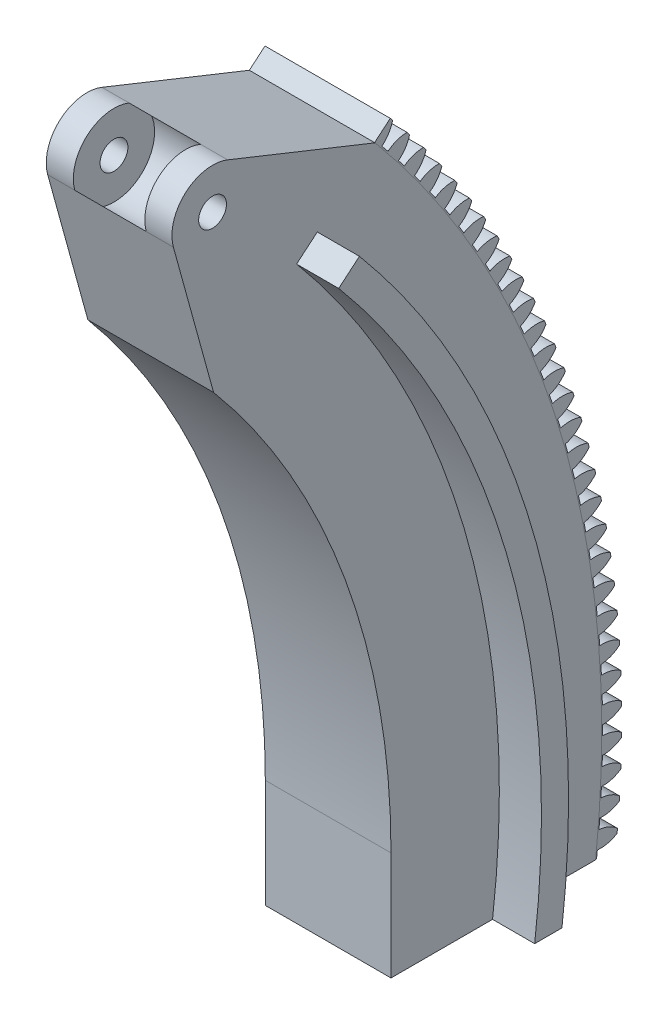
from build123d import *

# Parameters (mm, degrees)
BOSS_EXTRUDE2_DEPTH     = 6.35
BOSS_EXTRUDE3_DEPTH     = 29.464
CUT_EXTRUDE4_DEPTH      = 6.35
CIRPATTERN3_COUNT       = 230
CUT_EXTRUDE7_DEPTH      = 284.05774535
CUT_EXTRUDE7_DEPTH_BACK = 284.05774535
SKETCH15_R              = 3.2639
BOSS_EXTRUDE4_DEPTH     = 9.87425
BOSS_EXTRUDE6_START     = 23.01875
BOSS_EXTRUDE6_DEPTH     = 23.01875
SKETCH28_R              = 9.525
CUT_EXTRUDE8_DEPTH      = 16.764


with BuildPart() as part:
    # Sketch11 → Boss-Extrude2 (new body)
    with BuildSketch(Plane(origin=(6.35, 0, 0), x_dir=(0, 0, -1), z_dir=(1, 0, 0))):
        with BuildLine():
            Line((177.722316491, 149.126730219), (155.660230842, 130.614442288))
            ThreePointArc((155.660230842, 130.614442288), (190.945540544, 69.498493124), (203.2, 0))
            ThreePointArc((203.2, 0), (202.801171077, -12.724975829), (201.606249903, -25.4))
            Line((201.606249903, -25.4), (230.605384683, -25.4))
            ThreePointArc((230.605384683, -25.4), (231.65108936, -12.719129025), (232.000007424, 0))
            ThreePointArc((232.000007424, 0), (218.008694999, 79.348675791), (177.722316491, 149.126730219))
        make_face()
    extrude(amount=-BOSS_EXTRUDE2_DEPTH)

    # Sketch1 → Boss-Extrude3 (add)
    with BuildSketch(Plane(origin=(0, 0, 0), x_dir=(0, 0, -1), z_dir=(1, 0, 0))):
        with BuildLine():
            Line((177.8, 0), (177.8, -25.4))
            Line((177.8, -25.4), (225.775729431, -25.4))
            ThreePointArc((225.775729431, -25.4), (226.843652905, -12.71995034), (227.2, 0))
            ThreePointArc((227.2, 0), (213.498163443, 77.706976564), (174.045297477, 146.041344921))
            Line((174.045297477, 146.041344921), (139.503343029, 159.851365822))
            ThreePointArc((139.503343029, 159.851365822), (129.618020291, 158.107153482), (126.784391338, 148.47738561))
            Line((126.784391338, 148.47738561), (136.202701987, 114.287637002))
            ThreePointArc((136.202701987, 114.287637002), (167.077347976, 60.811181483), (177.8, 0))
        make_face()
    extrude(amount=BOSS_EXTRUDE3_DEPTH)

    # Sketch12 → Cut-Extrude4 (cut)
    with BuildSketch(Plane(origin=(6.35, 0, 0), x_dir=(0, 0, -1), z_dir=(1, 0, 0))):
        with BuildLine():
            ThreePointArc((227.497230324, 1.124058456), (230.494867292, 1.773780404), (232.972473, 3.581938572))
            ThreePointArc((232.972473, 3.581938572), (233.000007424, 0), (232.972473, -3.581938572))
            ThreePointArc((232.972473, -3.581938572), (230.494867292, -1.773780404), (227.497230324, -1.124058456))
            ThreePointArc((227.497230324, -1.124058456), (227.50000728, 0), (227.497230324, 1.124058456))
        make_face()
    cut_extrude4 = extrude(amount=-CUT_EXTRUDE4_DEPTH, mode=Mode.SUBTRACT)

    # CirPattern3: Cut-Extrude4 ×230 about axis
    cirpattern3_axis = Axis((0, 0, 0), (1, 0, 0))
    for i in range(1, CIRPATTERN3_COUNT):
        add(cut_extrude4.rotate(cirpattern3_axis, i * 360 / CIRPATTERN3_COUNT), mode=Mode.SUBTRACT)

    # Sketch15 → Cut-Extrude7 (cut, two sides: drawn at the far end of the back side and taken through both)
    with BuildSketch(Plane(origin=(6.35, 0, 0), x_dir=(0, 0, -1), z_dir=(1, 0, 0)).offset(-CUT_EXTRUDE7_DEPTH_BACK)):
        with Locations((135.967339212, 151.007028537)):
            Circle(SKETCH15_R)
    extrude(amount=CUT_EXTRUDE7_DEPTH + CUT_EXTRUDE7_DEPTH_BACK, mode=Mode.SUBTRACT)

    # Sketch23 → Boss-Extrude4 (add)
    with BuildSketch(Plane(origin=(0, 0, 0), x_dir=(0, 0, -1), z_dir=(1, 0, 0))):
        with BuildLine():
            Line((155.660230842, 130.614442288), (160.524613056, 134.69614361))
            ThreePointArc((160.524613056, 134.69614361), (196.912588686, 71.670321034), (209.55, 0))
            ThreePointArc((209.55, 0), (209.163370775, -12.723475387), (208.004909798, -25.4))
            Line((208.004909798, -25.4), (201.606249903, -25.4))
            ThreePointArc((201.606249903, -25.4), (202.801171077, -12.724975829), (203.2, 0))
            ThreePointArc((203.2, 0), (190.945540544, 69.498493124), (155.660230842, 130.614442288))
        make_face()
    boss_extrude4 = extrude(amount=-BOSS_EXTRUDE4_DEPTH)

    # Mirror2: Boss-Extrude4 across plane
    add(boss_extrude4.mirror(Plane(origin=(14.732, 0, 0), x_dir=(0, 0, 1), z_dir=(1, 0, 0))))

    # Sketch27 → Boss-Extrude6 (add)
    with BuildSketch(Plane(origin=(6.35, 0, 0), x_dir=(0, 0, -1), z_dir=(1, 0, 0)).offset(BOSS_EXTRUDE6_START)):
        with BuildLine():
            Line((177.722316491, 149.126730219), (174.045297477, 146.041344921))
            ThreePointArc((174.045297477, 146.041344921), (217.513785946, 65.632255207), (225.775729431, -25.4))
            Line((225.775729431, -25.4), (226.07762674, -25.4))
            ThreePointArc((226.07762674, -25.4), (226.171897735, -24.546404775), (226.262945845, -23.692459772))
            ThreePointArc((226.262945845, -23.692459772), (228.663101283, -23.551544215), (230.891757831, -22.649494707))
            ThreePointArc((230.891757831, -22.649494707), (230.94034564, -22.148593645), (230.987846786, -21.647588364))
            ThreePointArc((230.987846786, -21.647588364), (228.971262049, -20.338394215), (226.641640358, -19.743864063))
            ThreePointArc((226.641640358, -19.743864063), (226.736426656, -18.623805724), (226.825677683, -17.503292725))
            ThreePointArc((226.825677683, -17.503292725), (229.221088498, -17.296869983), (231.424274191, -16.33428174))
            ThreePointArc((231.424274191, -16.33428174), (231.459161859, -15.832240407), (231.492960423, -15.330124577))
            ThreePointArc((231.492960423, -15.330124577), (229.441367736, -14.07650152), (227.096375799, -13.545826347))
            ThreePointArc((227.096375799, -13.545826347), (227.160532561, -12.423596854), (227.219143699, -11.301064066))
            ThreePointArc((227.219143699, -11.301064066), (229.608022346, -11.029288179), (231.784093084, -10.006879521))
            ThreePointArc((231.784093084, -10.006879521), (231.805254577, -9.504072559), (231.825325337, -9.001220877))
            ThreePointArc((231.825325337, -9.001220877), (229.740255675, -7.804104412), (227.381643413, -7.337680228))
            ThreePointArc((227.381643413, -7.337680228), (227.415122764, -6.21411703), (227.443050275, -5.090402129))
            ThreePointArc((227.443050275, -5.090402129), (229.823614083, -4.753475906), (231.970946001, -3.672009792))
            ThreePointArc((231.970946001, -3.672009792), (231.978365527, -3.168812415), (231.984693505, -2.665600128))
            ThreePointArc((231.984693505, -2.665600128), (229.867702826, -1.525883589), (227.497230324, -1.124058456))
            ThreePointArc((227.497230324, -1.124058456), (227.50000728, 0), (227.497230324, 1.124058456))
            ThreePointArc((227.497230324, 1.124058456), (229.867702826, 1.525883589), (231.984693505, 2.665600128))
            ThreePointArc((231.984693505, 2.665600128), (231.978365527, 3.168812415), (231.970946001, 3.672009792))
            ThreePointArc((231.970946001, 3.672009792), (229.823614083, 4.753475906), (227.443050275, 5.090402129))
            ThreePointArc((227.443050275, 5.090402129), (227.415122764, 6.21411703), (227.381643413, 7.337680228))
            ThreePointArc((227.381643413, 7.337680228), (229.740255675, 7.804104412), (231.825325337, 9.001220877))
            ThreePointArc((231.825325337, 9.001220877), (231.805254577, 9.504072559), (231.784093084, 10.006879521))
            ThreePointArc((231.784093084, 10.006879521), (229.608022346, 11.029288179), (227.219143699, 11.301064066))
            ThreePointArc((227.219143699, 11.301064066), (227.160532561, 12.423596854), (227.096375799, 13.545826347))
            ThreePointArc((227.096375799, 13.545826347), (229.441367736, 14.07650152), (231.492960423, 15.330124577))
            ThreePointArc((231.492960423, 15.330124577), (231.459161859, 15.832240407), (231.424274191, 16.33428174))
            ThreePointArc((231.424274191, 16.33428174), (229.221088498, 17.296869983), (226.825677683, 17.503292725))
            ThreePointArc((226.825677683, 17.503292725), (226.736426656, 18.623805724), (226.641640358, 19.743864063))
            ThreePointArc((226.641640358, 19.743864063), (228.971262049, 20.338394215), (230.987846786, 21.647588364))
            ThreePointArc((230.987846786, 21.647588364), (230.94034564, 22.148593645), (230.891757831, 22.649494707))
            ThreePointArc((230.891757831, 22.649494707), (228.663101283, 23.551544215), (226.262945845, 23.692459772))
            ThreePointArc((226.262945845, 23.692459772), (226.143121532, 24.810116812), (226.017776432, 25.927168167))
            ThreePointArc((226.017776432, 25.927168167), (228.330289425, 26.585109638), (230.310361361, 27.94889791))
            ThreePointArc((230.310361361, 27.94889791), (230.24919308, 28.448418771), (230.186941388, 28.947805772))
            ThreePointArc((230.186941388, 28.947805772), (227.934477093, 29.788643403), (225.531368117, 29.863946617))
            ThreePointArc((225.531368117, 29.863946617), (225.381059935, 30.977913661), (225.225249571, 32.091124447))
            ThreePointArc((225.225249571, 32.091124447), (227.518928183, 32.811986256), (229.461009714, 34.22935094))
            ThreePointArc((229.461009714, 34.22935094), (229.386219944, 34.727014622), (229.310350824, 35.2245149))
            ThreePointArc((229.310350824, 35.2245149), (227.035759654, 36.003513188), (224.631490431, 36.013147865))
            ThreePointArc((224.631490431, 36.013147865), (224.450810546, 37.12259363), (224.264651187, 38.231133128))
            ThreePointArc((224.264651187, 38.231133128), (226.537783789, 39.01437734), (228.440425662, 40.484260746))
            ThreePointArc((228.440425662, 40.484260746), (228.352070214, 40.979695873), (228.262640281, 41.474938174))
            ThreePointArc((228.262640281, 41.474938174), (225.967619622, 42.191515802), (223.563984308, 42.135474753))
            ThreePointArc((223.563984308, 42.135474753), (223.353067549, 43.239571328), (223.136698117, 44.342612304))
            ThreePointArc((223.136698117, 44.342612304), (225.387588412, 45.187654434), (227.249370803, 46.70895968))
            ThreePointArc((227.249370803, 46.70895968), (227.147515611, 47.201796539), (227.044591603, 47.694411295))
            ThreePointArc((227.044591603, 47.694411295), (224.730854085, 48.348033526), (222.329646362, 48.226358571))
            ThreePointArc((222.329646362, 48.226358571), (222.088650124, 49.324282038), (221.84223208, 50.421001361))
            ThreePointArc((221.84223208, 50.421001361), (224.06920037, 51.327210806), (225.888733947, 52.898802637))
            ThreePointArc((225.888733947, 52.898802637), (225.773455019, 53.388673455), (225.657113741, 53.878293059))
            ThreePointArc((225.657113741, 53.878293059), (223.326385962, 54.468472135), (220.929397701, 54.281254073))
            ThreePointArc((220.929397701, 54.281254073), (220.658501825, 55.37218512), (220.382219056, 56.461764377))
            ThreePointArc((220.382219056, 56.461764377), (222.583603493, 57.428464891), (224.359530453, 59.049170525))
            ThreePointArc((224.359530453, 59.049170525), (224.230913815, 59.535709743), (224.101242084, 60.021968822))
            ThreePointArc((224.101242084, 60.021968822), (221.75526332, 60.54826433), (219.364283245, 60.295642869))
            ThreePointArc((219.364283245, 60.295642869), (219.063689882, 61.378767402), (218.75774856, 62.460393508))
            ThreePointArc((218.75774856, 62.460393508), (220.931906389, 63.486863702), (222.662901469, 65.15547371))
            ThreePointArc((222.662901469, 65.15547371), (222.521043099, 65.638318252), (222.378137682, 66.120853942))
            ThreePointArc((222.378137682, 66.120853942), (220.01865859, 66.58287314), (217.635470939, 66.265036796))
            ThreePointArc((217.635470939, 66.265036796), (217.305404404, 67.339546548), (216.970032835, 68.412412353))
            ThreePointArc((216.970032835, 68.412412353), (219.115341617, 69.497886237), (220.800113083, 71.213155438))
            ThreePointArc((220.800113083, 71.213155438), (220.645118841, 71.691944989), (220.489086379, 72.170397203))
            ThreePointArc((220.489086379, 72.170397203), (218.117867692, 72.567795315), (215.744250889, 72.18498127))
            ThreePointArc((215.744250889, 72.18498127), (215.384957489, 73.250074401), (215.02040594, 74.313379293))
            ThreePointArc((215.02040594, 74.313379293), (217.135264766, 75.457046844), (218.772555378, 77.21769524))
            ThreePointArc((218.772555378, 77.21769524), (218.604540927, 77.69207251), (218.435497858, 78.166084208))
            ThreePointArc((218.435497858, 78.166084208), (216.054309067, 78.498564682), (213.692034393, 78.051058605))
            ThreePointArc((213.692034393, 78.051058605), (213.303782248, 79.105940303), (212.91032276, 80.158890803))
            ThreePointArc((212.91032276, 80.158890803), (214.993153443, 81.359898575), (216.581741393, 83.164612305))
            ThreePointArc((216.581741393, 83.164612305), (216.400832112, 83.634223294), (216.218904581, 84.103440753))
            ThreePointArc((216.218904581, 84.103440753), (213.829522619, 84.370755478), (211.480352893, 83.858891315))
            ThreePointArc((211.480352893, 83.858891315), (211.06343173, 84.902774388), (210.641357917, 85.944584746))
            ThreePointArc((210.641357917, 85.944584746), (212.690606171, 87.202036501), (214.229305997, 89.049468819))
            ThreePointArc((214.229305997, 89.049468819), (214.035636886, 89.513963087), (213.840960655, 89.978036158))
            ThreePointArc((213.840960655, 89.978036158), (211.445168568, 90.179985654), (209.110856828, 89.604145378))
            ThreePointArc((209.110856828, 89.604145378), (208.66557777, 90.63625084), (208.2152046, 91.666143618))
            ThreePointArc((208.2152046, 91.666143618), (210.229341199, 92.979100999), (211.717004663, 94.867873282))
            ThreePointArc((211.717004663, 94.867873282), (211.510720247, 95.326904206), (211.30344059, 95.78548658))
            ThreePointArc((211.30344059, 95.78548658), (208.903026208, 95.921920145), (206.585314405, 95.28253347))
            ThreePointArc((206.585314405, 95.28253347), (206.112009735, 96.302091126), (205.633673294, 97.319297778))
            ThreePointArc((205.633673294, 97.319297778), (207.611195213, 98.686781007), (209.046712167, 100.615483783))
            ThreePointArc((209.046712167, 100.615483783), (208.827966381, 101.068708817), (208.608237979, 101.521458283))
            ThreePointArc((208.608237979, 101.521458283), (206.204992582, 101.592274105), (203.905610279, 100.889818164))
            ThreePointArc((203.905610279, 100.889818164), (203.404633195, 101.896067182), (202.898690434, 102.899828632))
            ThreePointArc((202.898690434, 102.899828632), (204.838121973, 104.320817242), (206.220421179, 106.28801124))
            ThreePointArc((206.220421179, 106.28801124), (205.989377261, 106.735092169), (205.757364083, 107.181670869))
            ThreePointArc((205.757364083, 107.181670869), (203.353081061, 107.186816103), (201.073744144, 106.421815095))
            ThreePointArc((201.073744144, 106.421815095), (200.545468495, 107.414004574), (200.012296968, 108.403571777))
            ThreePointArc((200.012296968, 108.403571777), (201.91219085, 109.877005372), (203.240240785, 111.881222599))
            ThreePointArc((203.240240785, 111.881222599), (202.997071148, 112.321825796), (202.752946331, 112.761900475))
            ThreePointArc((202.752946331, 112.761900475), (200.349419851, 112.701371281), (198.091829247, 111.874396079))
            ThreePointArc((198.091829247, 111.874396079), (197.53664925, 112.851785611), (196.97664683, 113.826420114))
            ThreePointArc((196.97664683, 113.826420114), (198.835585283, 115.351199164), (200.108394907, 117.390943997))
            ThreePointArc((200.108394907, 117.390943997), (199.853281013, 117.824740666), (199.597226732, 118.257982925))
            ThreePointArc((199.597226732, 118.257982925), (197.196250396, 118.131824473), (194.962090802, 117.243492197))
            ThreePointArc((194.962090802, 117.243492197), (194.380420754, 118.205352416), (193.794005336, 119.164326911))
            ThreePointArc((193.794005336, 119.164326911), (195.610601151, 120.739313568), (196.827220645, 122.813063873))
            ThreePointArc((196.827220645, 122.813063873), (196.56035287, 123.2397303), (196.292560202, 123.665816837))
            ThreePointArc((196.292560202, 123.665816837), (193.895925708, 123.47412327), (191.686864339, 122.525096826))
            ThreePointArc((191.686864339, 122.525096826), (191.079138305, 123.470709957), (190.466747493, 124.413308821))
            ThreePointArc((190.466747493, 124.413308821), (192.239645057, 126.037327771), (193.399166535, 128.143536038))
            ThreePointArc((193.399166535, 128.143536038), (193.120744025, 128.562753829), (192.841412808, 128.981366682))
            ThreePointArc((192.841412808, 128.981366682), (190.450908614, 128.724281049), (188.268593954, 127.715268637))
            ThreePointArc((188.268593954, 127.715268637), (187.635265441, 128.643929027), (186.997356225, 129.569448858))
            ThreePointArc((186.997356225, 129.569448858), (188.725232536, 131.241288196), (189.826790719, 133.378382695))
            ThreePointArc((189.826790719, 133.378382695), (189.537021244, 133.789839012), (189.246359924, 134.200665797))
            ThreePointArc((189.246359924, 134.200665797), (186.863769915, 133.878379945), (184.709830489, 132.810134528))
            ThreePointArc((184.709830489, 132.810134528), (184.05137211, 133.721149176), (183.388420522, 134.628899316))
            ThreePointArc((183.388420522, 134.628899316), (185.069986174, 136.347311455), (186.112759037, 138.513697403))
            ThreePointArc((186.112759037, 138.513697403), (185.811858834, 138.917085204), (185.510084314, 139.319819345))
            ThreePointArc((185.510084314, 139.319819345), (183.137186467, 138.932573777), (181.013229625, 137.805892519))
            ThreePointArc((181.013229625, 137.805892519), (180.330132748, 138.698581592), (179.642633506, 139.587884644))
            ThreePointArc((179.642633506, 139.587884644), (181.276633653, 141.351587239), (182.25984304, 143.545648))
            ThreePointArc((182.25984304, 143.545648), (181.948036652, 143.94066626), (181.635374127, 144.335007224))
            ThreePointArc((181.635374127, 144.335007224), (179.273939188, 143.883090915), (177.181549907, 142.698814589))
            ThreePointArc((177.181549907, 142.698814589), (176.474324282, 143.572511928), (175.762790426, 144.442704261))
            ThreePointArc((175.762790426, 144.442704261), (177.348005713, 146.250381172), (178.270917918, 148.470479455))
            ThreePointArc((178.270917918, 148.470479455), (177.996919643, 148.798857665), (177.722316491, 149.126730219))
        make_face()
    extrude(amount=-BOSS_EXTRUDE6_DEPTH)

    # Sketch28 → Cut-Extrude8 (cut)
    with BuildSketch(Plane(origin=(6.35, 0, 0), x_dir=(0, 0, -1), z_dir=(1, 0, 0))):
        with Locations((135.967339212, 151.007028537)):
            Circle(SKETCH28_R)
    extrude(amount=CUT_EXTRUDE8_DEPTH, mode=Mode.SUBTRACT)


solid = part.part
